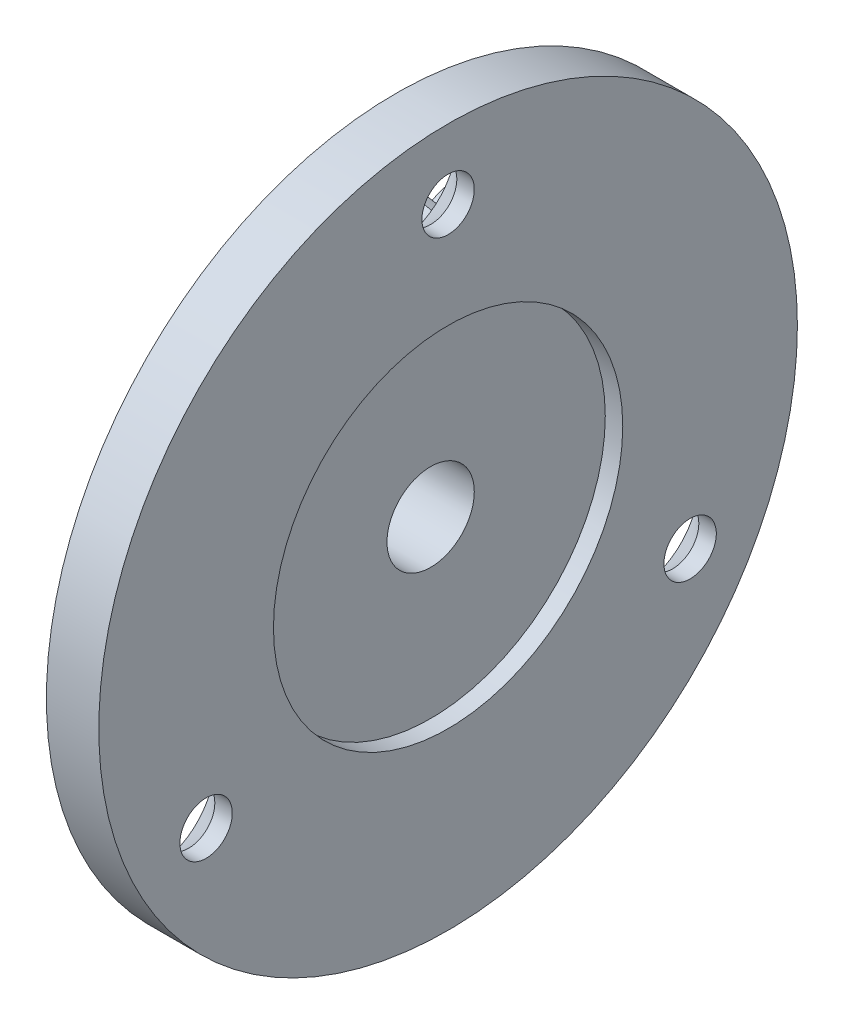
from build123d import *

# Parameters (mm, degrees)
BASPROSKE_W            = 5
BASPROSKE_H            = 11.870399894
TOOTHCUTRH_PITCH       = 278.350987101
TOOTHCUTRH_HEIGHT      = 5
TOOTHCUTRH_RADIUS      = 11.870399894
TOOTHCUTRH_START_ANGLE = -90
TEETHCUTSRH_COUNT      = 21
TEETHCUTSRH_ANGLE      = 342.857142857
BORSKE_R               = 2.5
BORE_DEPTH             = 62.5000025
EXTRUDE_START          = 3
SKETCH_1_R             = 20
SKETCH_1_R_2           = 2.5
EXTRUDE_1_DEPTH        = 3
SKETCH_2_R             = 1.5
CUT_EXTRUDE_1_DEPTH    = 29.722813389
CHAMFER_1_SIZE         = 2
SKETCH_3_R             = 10
CUT_EXTRUDE_2_DEPTH    = 1


with BuildPart() as part:
    # BasProSke → Base-Revolve (revolve)
    with BuildSketch(Plane(origin=(0, 0, 0), x_dir=(1, 0, 0), z_dir=(0, 1, 0)), mode=Mode.PRIVATE) as base_revolve_sk:
        with Locations((2.5, 5.935199947)):
            Rectangle(BASPROSKE_W, BASPROSKE_H)
    revolve(base_revolve_sk.sketch.rotate(Axis((-10, 0, 0), (1, 0, 0)), 180), axis=Axis((-10, 0, 0), (1, 0, 0)))

    # ToothCutRH: sweep along a helix
    with BuildLine() as toothcutrh_path:
        add(Helix(TOOTHCUTRH_PITCH, TOOTHCUTRH_HEIGHT, TOOTHCUTRH_RADIUS, center=(0, 0, 0), direction=(1, 0, 0), mode=Mode.PRIVATE).rotate(Axis((0, 0, 0), (1, 0, 0)), TOOTHCUTRH_START_ANGLE))
    # TooCutSkeRH → ToothCutRH (sweep, cut)
    with BuildSketch(Plane(origin=(0, 0, 0), x_dir=(0, 0, -1), z_dir=(1, 0, 0))):
        with BuildLine():
            ThreePointArc((0.187600664, 9.618570586), (0, 9.620399894), (-0.187600664, 9.618570586))
            ThreePointArc((-0.187600664, 9.618570586), (-0.345073694, 9.670222043), (-0.436029318, 9.808759774))
            ThreePointArc((-0.436029318, 9.808759774), (-0.913637647, 11.038399188), (-1.682685813, 12.11016769))
            ThreePointArc((-1.682685813, 12.11016769), (0, 12.226511891), (1.682685813, 12.11016769))
            ThreePointArc((1.682685813, 12.11016769), (0.913637647, 11.038399188), (0.436029318, 9.808759774))
            ThreePointArc((0.436029318, 9.808759774), (0.345073694, 9.670222043), (0.187600664, 9.618570586))
        make_face()
    toothcutrh = sweep(path=toothcutrh_path.line, is_frenet=True, mode=Mode.SUBTRACT)

    # TeethCutsRH: ToothCutRH ×21 about axis
    teethcutsrh_axis = Axis((-10, 0, 0), (1, 0, 0))
    for i in range(1, TEETHCUTSRH_COUNT):
        add(toothcutrh.rotate(teethcutsrh_axis, i * TEETHCUTSRH_ANGLE / (TEETHCUTSRH_COUNT - 1)), mode=Mode.SUBTRACT)

    # BorSke → Bore (cut, symmetric)
    with BuildSketch(Plane(origin=(0, 0, 0), x_dir=(0, 0, -1), z_dir=(1, 0, 0))):
        with Locations(Location((0, 0, 0), (0, 0, 180))):
            Circle(BORSKE_R)
    extrude(amount=BORE_DEPTH, both=True, mode=Mode.SUBTRACT)

    # Эскиз1 → Бобышка-Вытянуть1 (add)
    with BuildSketch(Plane(origin=(5, 0, 0), x_dir=(0, 0, -1), z_dir=(1, 0, 0)).offset(EXTRUDE_START)):
        Circle(SKETCH_1_R)
        Circle(SKETCH_1_R_2, mode=Mode.SUBTRACT)
    extrude(amount=-EXTRUDE_1_DEPTH)

    # Эскиз2 → Вырез-Вытянуть1 (cut, through all)
    with BuildSketch(Plane.ZY.offset(-5)):
        with Locations((0, 16)):
            Circle(SKETCH_2_R)
        with Locations((13.856406461, -8)):
            Circle(SKETCH_2_R)
        with Locations((-13.856406461, -8)):
            Circle(SKETCH_2_R)
    extrude(amount=-CUT_EXTRUDE_1_DEPTH, mode=Mode.SUBTRACT)

    # Фаска1
    chamfer_1_edges = [part.edges().sort_by_distance(p)[0] for p in [
        (5, 16, -1.5),
        (5, -8, 12.356406461),
        (5, -8, -15.356406461),
    ]]
    chamfer(chamfer_1_edges, length=CHAMFER_1_SIZE)

    # Эскиз3 → Вырез-Вытянуть2 (cut)
    with BuildSketch(Plane(origin=(8, 0, 0), x_dir=(0, 0, -1), z_dir=(1, 0, 0))):
        Circle(SKETCH_3_R)
    extrude(amount=-CUT_EXTRUDE_2_DEPTH, mode=Mode.SUBTRACT)


solid = part.part
